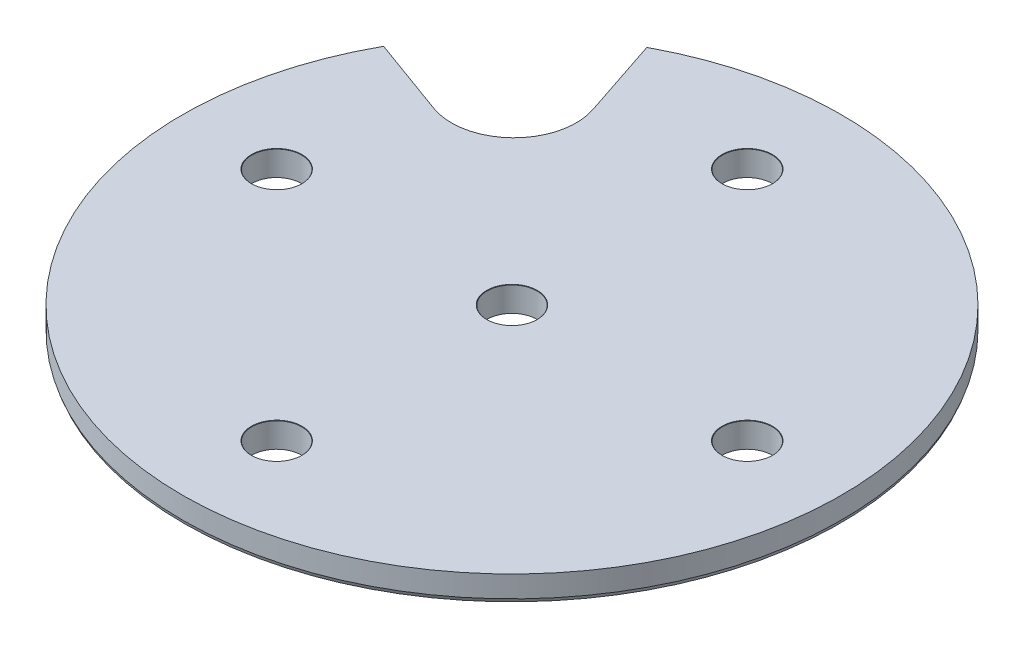
from build123d import *

# Parameters (mm, degrees)
SKETCH1_R                         = 26.4
BOSS_EXTRUDE1_DEPTH               = 2
F_4_0_4_DIAMETER_HOLE1_AT_2_COUNT = 2
F_4_0_4_DIAMETER_HOLE1_AT_2_PITCH = 18.85
F_4_0_4_DIAMETER_HOLE1_AT_3_COUNT = 2
F_4_0_4_DIAMETER_HOLE1_AT_3_PITCH = 18.85
F_4_0_4_DIAMETER_HOLE1_AT_4_COUNT = 2
F_4_0_4_DIAMETER_HOLE1_AT_4_PITCH = 18.85
F_4_0_4_DIAMETER_HOLE1_AT_5_COUNT = 2
F_4_0_4_DIAMETER_HOLE1_AT_5_PITCH = 18.85
CHAMFER1_SIZE                     = 0.1
CHAMFER1_SIZE2                    = 0.274747742
CUT_EXTRUDE1_DEPTH                = 38.388768367


with BuildPart() as part:
    # Sketch1 → Boss-Extrude1 (new body)
    with BuildSketch(Plane(origin=(0, 0, 0), x_dir=(1, 0, 0), z_dir=(0, 1, 0))):
        Circle(SKETCH1_R)
    extrude(amount=BOSS_EXTRUDE1_DEPTH)

    # Sketch4 → Ø4.0 (4) Diameter Hole1 (revolve, cut)
    with BuildSketch(Plane(origin=(0, 2, 0), x_dir=(0, 0, 1), z_dir=(1, 0, 0))):
        Polygon((0, 0), (0, 2), (2, 2), (2, 0.027282713), (2.025, 0), align=None)
    f_4_0_4_diameter_hole1 = revolve(axis=Axis((0, 8.35, 0), (0, -1, 0)), mode=Mode.SUBTRACT)

    # Ø4.0 (4) Diameter Hole1 at 2: Ø4.0 (4) Diameter Hole1 ×2
    with Locations(*[(-i * F_4_0_4_DIAMETER_HOLE1_AT_2_PITCH, 0, 0) for i in range(1, F_4_0_4_DIAMETER_HOLE1_AT_2_COUNT)]):
        add(f_4_0_4_diameter_hole1, mode=Mode.SUBTRACT)

    # Ø4.0 (4) Diameter Hole1 at 3: Ø4.0 (4) Diameter Hole1 ×2
    with Locations(*[(0, 0, -i * F_4_0_4_DIAMETER_HOLE1_AT_3_PITCH) for i in range(1, F_4_0_4_DIAMETER_HOLE1_AT_3_COUNT)]):
        add(f_4_0_4_diameter_hole1, mode=Mode.SUBTRACT)

    # Ø4.0 (4) Diameter Hole1 at 4: Ø4.0 (4) Diameter Hole1 ×2
    with Locations(*[(i * F_4_0_4_DIAMETER_HOLE1_AT_4_PITCH, 0, 0) for i in range(1, F_4_0_4_DIAMETER_HOLE1_AT_4_COUNT)]):
        add(f_4_0_4_diameter_hole1, mode=Mode.SUBTRACT)

    # Ø4.0 (4) Diameter Hole1 at 5: Ø4.0 (4) Diameter Hole1 ×2
    with Locations(*[(0, 0, i * F_4_0_4_DIAMETER_HOLE1_AT_5_PITCH) for i in range(1, F_4_0_4_DIAMETER_HOLE1_AT_5_COUNT)]):
        add(f_4_0_4_diameter_hole1, mode=Mode.SUBTRACT)

    # Chamfer1
    chamfer1_edges = [part.edges().sort_by_distance(p)[0] for p in [
        (-26.4, 0, 0),
    ]]
    chamfer1_side = [part.faces().sort_by_distance(p)[0] for p in [
        (-25.653295239, 0, 0),
    ]]
    chamfer(chamfer1_edges, length=CHAMFER1_SIZE, length2=CHAMFER1_SIZE2, reference=chamfer1_side[0])

    # Sketch5 → Cut-Extrude1 (cut, through all)
    with BuildSketch(Plane(origin=(0, 2, 0), x_dir=(1, 0, 0), z_dir=(0, 1, 0))):
        with BuildLine():
            Line((-23.086392584, 12.805408134), (-16.76402379, 10.508028737))
            ThreePointArc((-16.76402379, 10.508028737), (-11.570483497, 11.622928999), (-10.311269735, 16.783378987))
            Line((-10.311269735, 16.783378987), (-12.466103662, 23.271361359))
            ThreePointArc((-12.466103662, 23.271361359), (-18.530489512, 18.803748521), (-23.086392584, 12.805408134))
        make_face()
    extrude(amount=-CUT_EXTRUDE1_DEPTH, mode=Mode.SUBTRACT)


solid = part.part
